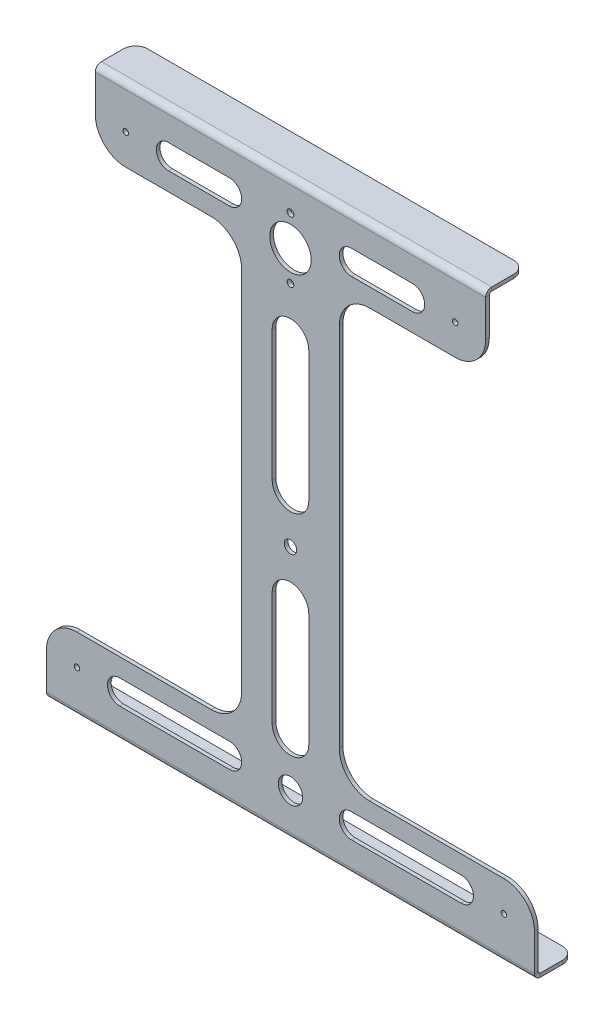
from build123d import *

# Parameters (mm, degrees)
ESQUISSE1_W                             = 400
ESQUISSE1_H                             = 470
BOSS_EXTRU_1_DEPTH                      = 3
T_LE_PLI_E_SUR_AR_TE1_STRIP_W           = 16
T_LE_PLI_E_SUR_AR_TE1_STRIP_H           = 3
T_LE_PLI_E_SUR_AR_TE1_STRIP_CUT_DEPTH   = 400
T_LE_PLI_E_SUR_AR_TE1_STRIP_2_W         = 16
T_LE_PLI_E_SUR_AR_TE1_STRIP_2_H         = 3
T_LE_PLI_E_SUR_AR_TE1_STRIP_CUT_2_DEPTH = 400
T_LE_PLI_E_SUR_AR_TE1_DEPTH             = 400
T_LE_PLI_E_SUR_AR_TE1_BEND_DEPTH        = 400
ENL_V_MAT_EXTRU_1_REACH                 = 513.849
ESQUISSE7_R                             = 5.1
ESQUISSE7_R_2                           = 17
ESQUISSE7_R_3                           = 2.75
ESQUISSE7_R_4                           = 2.25
ENL_V_MAT_EXTRU_6_REACH                 = 513.849
ESQUISSE14_R                            = 10
CONG_10_R                               = 10
CONG_2_R                                = 25
ENL_V_MAT_EXTRU_2_REACH                 = 513.664
ESQUISSE8_R                             = 2.25


# Sheet-metal steps are written as plain solids
with BuildPart() as part:
    # Esquisse1 → Boss.-Extru.1 (new body)
    with BuildSketch(Plane.XY):
        with Locations((0, 235)):
            Rectangle(ESQUISSE1_W, ESQUISSE1_H)
    extrude(amount=BOSS_EXTRU_1_DEPTH)

    # Tôle pliée sur arête1 strip (across the edge) → Tôle pliée sur arête1 strip cut (cut)
    with BuildSketch(Plane(origin=(-200, 470, 0), x_dir=(0, -1, 0), z_dir=(1, 0, 0))):
        with Locations((-3, -1.5)):
            Rectangle(T_LE_PLI_E_SUR_AR_TE1_STRIP_W, T_LE_PLI_E_SUR_AR_TE1_STRIP_H)
    extrude(amount=T_LE_PLI_E_SUR_AR_TE1_STRIP_CUT_DEPTH, mode=Mode.SUBTRACT)

    # Tôle pliée sur arête1 strip 2 (across the edge) → Tôle pliée sur arête1 strip cut 2 (cut)
    with BuildSketch(Plane(origin=(200, 0, 0), x_dir=(0, 1, 0), z_dir=(-1, 0, 0))):
        with Locations((-3, -1.5)):
            Rectangle(T_LE_PLI_E_SUR_AR_TE1_STRIP_2_W, T_LE_PLI_E_SUR_AR_TE1_STRIP_2_H)
    extrude(amount=T_LE_PLI_E_SUR_AR_TE1_STRIP_CUT_2_DEPTH, mode=Mode.SUBTRACT)

    # Tôle pliée sur arête1 section (across the edge) → Tôle pliée sur arête1 (add)
    with BuildSketch(Plane(origin=(-200, 470, 0), x_dir=(0, -1, 0), z_dir=(1, 0, 0))):
        with BuildLine():
            Line((0, 2), (0, 30))
            Line((0, 30), (3, 30))
            Line((3, 30), (3, 2))
            ThreePointArc((3, 2), (3.585786438, 0.585786438), (5, 0))
            Line((5, 0), (5, -3))
            ThreePointArc((5, -3), (1.464466094, -1.535533906), (0, 2))
        make_face()
    extrude(amount=T_LE_PLI_E_SUR_AR_TE1_DEPTH)

    # Tôle pliée sur arête1 section 2 (across the edge) → Tôle pliée sur arête1 bend (add)
    with BuildSketch(Plane(origin=(200, 0, 0), x_dir=(0, 1, 0), z_dir=(-1, 0, 0))):
        with BuildLine():
            Line((0, 2), (0, 30))
            Line((0, 30), (3, 30))
            Line((3, 30), (3, 2))
            ThreePointArc((3, 2), (3.585786438, 0.585786438), (5, 0))
            Line((5, 0), (5, -3))
            ThreePointArc((5, -3), (1.464466094, -1.535533906), (0, 2))
        make_face()
    extrude(amount=T_LE_PLI_E_SUR_AR_TE1_BEND_DEPTH)

    # Esquisse7 → Enlèv. mat.-Extru.1 (cut, up to next)
    with BuildSketch(Plane.XY.offset(3), mode=Mode.PRIVATE) as enl_v_mat_extru_1_sk1:
        with Locations((0, 208)):
            Circle(ESQUISSE7_R)
    enl_v_mat_extru_1_tool1 = extrude(enl_v_mat_extru_1_sk1.sketch, amount=-ENL_V_MAT_EXTRU_1_REACH, mode=Mode.PRIVATE) & part.part
    # Esquisse7 → Enlèv. mat.-Extru.1 (cut, up to next)
    with BuildSketch(Plane.XY.offset(3), mode=Mode.PRIVATE) as enl_v_mat_extru_1_sk2:
        with Locations((0, 420)):
            Circle(ESQUISSE7_R_2)
    enl_v_mat_extru_1_tool2 = extrude(enl_v_mat_extru_1_sk2.sketch, amount=-ENL_V_MAT_EXTRU_1_REACH, mode=Mode.PRIVATE) & part.part
    # Esquisse7 → Enlèv. mat.-Extru.1 (cut, up to next)
    with BuildSketch(Plane.XY.offset(3), mode=Mode.PRIVATE) as enl_v_mat_extru_1_sk3:
        with Locations((0, 445)):
            Circle(ESQUISSE7_R_3)
    enl_v_mat_extru_1_tool3 = extrude(enl_v_mat_extru_1_sk3.sketch, amount=-ENL_V_MAT_EXTRU_1_REACH, mode=Mode.PRIVATE) & part.part
    # Esquisse7 → Enlèv. mat.-Extru.1 (cut, up to next)
    with BuildSketch(Plane.XY.offset(3), mode=Mode.PRIVATE) as enl_v_mat_extru_1_sk4:
        with Locations((0, 395)):
            Circle(ESQUISSE7_R_3)
    enl_v_mat_extru_1_tool4 = extrude(enl_v_mat_extru_1_sk4.sketch, amount=-ENL_V_MAT_EXTRU_1_REACH, mode=Mode.PRIVATE) & part.part
    # Esquisse7 → Enlèv. mat.-Extru.1 (cut, up to next)
    with BuildSketch(Plane.XY.offset(3), mode=Mode.PRIVATE) as enl_v_mat_extru_1_sk5:
        with Locations((-175, 35)):
            Circle(ESQUISSE7_R_4)
    enl_v_mat_extru_1_tool5 = extrude(enl_v_mat_extru_1_sk5.sketch, amount=-ENL_V_MAT_EXTRU_1_REACH, mode=Mode.PRIVATE) & part.part
    # Esquisse7 → Enlèv. mat.-Extru.1 (cut, up to next)
    with BuildSketch(Plane.XY.offset(3), mode=Mode.PRIVATE) as enl_v_mat_extru_1_sk6:
        with Locations((175, 35)):
            Circle(ESQUISSE7_R_4)
    enl_v_mat_extru_1_tool6 = extrude(enl_v_mat_extru_1_sk6.sketch, amount=-ENL_V_MAT_EXTRU_1_REACH, mode=Mode.PRIVATE) & part.part
    # Esquisse7 → Enlèv. mat.-Extru.1 (cut, up to next)
    with BuildSketch(Plane.XY.offset(3), mode=Mode.PRIVATE) as enl_v_mat_extru_1_sk7:
        with Locations((-135, 435)):
            Circle(ESQUISSE7_R_4)
    enl_v_mat_extru_1_tool7 = extrude(enl_v_mat_extru_1_sk7.sketch, amount=-ENL_V_MAT_EXTRU_1_REACH, mode=Mode.PRIVATE) & part.part
    # Esquisse7 → Enlèv. mat.-Extru.1 (cut, up to next)
    with BuildSketch(Plane.XY.offset(3), mode=Mode.PRIVATE) as enl_v_mat_extru_1_sk8:
        with Locations((135, 435)):
            Circle(ESQUISSE7_R_4)
    enl_v_mat_extru_1_tool8 = extrude(enl_v_mat_extru_1_sk8.sketch, amount=-ENL_V_MAT_EXTRU_1_REACH, mode=Mode.PRIVATE) & part.part
    # Esquisse7 → Enlèv. mat.-Extru.1 (cut, up to next)
    with BuildSketch(Plane.XY.offset(3), mode=Mode.PRIVATE) as enl_v_mat_extru_1_sk9:
        Polygon((-200, 60), (-40, 60), (-40, 410), (-160, 410), (-160, 470), (-200, 470), align=None)
    enl_v_mat_extru_1_tool9 = extrude(enl_v_mat_extru_1_sk9.sketch, amount=-ENL_V_MAT_EXTRU_1_REACH, mode=Mode.PRIVATE) & part.part
    # Esquisse7 → Enlèv. mat.-Extru.1 (cut, up to next)
    with BuildSketch(Plane.XY.offset(3), mode=Mode.PRIVATE) as enl_v_mat_extru_1_sk10:
        Polygon((200, 470), (200, 60), (40, 60), (40, 410), (160, 410), (160, 470), align=None)
    enl_v_mat_extru_1_tool10 = extrude(enl_v_mat_extru_1_sk10.sketch, amount=-ENL_V_MAT_EXTRU_1_REACH, mode=Mode.PRIVATE) & part.part
    add(enl_v_mat_extru_1_tool1.solids().sort_by_distance((0, 208, 3))[0], mode=Mode.SUBTRACT)
    add(enl_v_mat_extru_1_tool2.solids().sort_by_distance((0, 420, 3))[0], mode=Mode.SUBTRACT)
    add(enl_v_mat_extru_1_tool3.solids().sort_by_distance((0, 445, 3))[0], mode=Mode.SUBTRACT)
    add(enl_v_mat_extru_1_tool4.solids().sort_by_distance((0, 395, 3))[0], mode=Mode.SUBTRACT)
    add(enl_v_mat_extru_1_tool5.solids().sort_by_distance((-175, 35, 3))[0], mode=Mode.SUBTRACT)
    add(enl_v_mat_extru_1_tool6.solids().sort_by_distance((175, 35, 3))[0], mode=Mode.SUBTRACT)
    add(enl_v_mat_extru_1_tool7.solids().sort_by_distance((-135, 435, 3))[0], mode=Mode.SUBTRACT)
    add(enl_v_mat_extru_1_tool8.solids().sort_by_distance((135, 435, 3))[0], mode=Mode.SUBTRACT)
    add(enl_v_mat_extru_1_tool9.solids().sort_by_distance((-122.465753, 243.424658, 3))[0], mode=Mode.SUBTRACT)
    add(enl_v_mat_extru_1_tool10.solids().sort_by_distance((122.465753, 243.424658, 3))[0], mode=Mode.SUBTRACT)

    # Esquisse14 → Enlèv. mat.-Extru.6 (cut, up to next)
    with BuildSketch(Plane.XY.offset(3), mode=Mode.PRIVATE) as enl_v_mat_extru_6_sk1:
        with Locations((0, 35)):
            Circle(ESQUISSE14_R)
    enl_v_mat_extru_6_tool1 = extrude(enl_v_mat_extru_6_sk1.sketch, amount=-ENL_V_MAT_EXTRU_6_REACH, mode=Mode.PRIVATE) & part.part
    # Esquisse14 → Enlèv. mat.-Extru.6 (cut, up to next)
    with BuildSketch(Plane.XY.offset(3), mode=Mode.PRIVATE) as enl_v_mat_extru_6_sk2:
        with BuildLine():
            Line((-140, 45), (-50, 45))
            ThreePointArc((-50, 45), (-40, 35), (-50, 25))
            Line((-50, 25), (-140, 25))
            ThreePointArc((-140, 25), (-150, 35), (-140, 45))
        make_face()
    enl_v_mat_extru_6_tool2 = extrude(enl_v_mat_extru_6_sk2.sketch, amount=-ENL_V_MAT_EXTRU_6_REACH, mode=Mode.PRIVATE) & part.part
    # Esquisse14 → Enlèv. mat.-Extru.6 (cut, up to next)
    with BuildSketch(Plane.XY.offset(3), mode=Mode.PRIVATE) as enl_v_mat_extru_6_sk3:
        with BuildLine():
            Line((50, 45), (140, 45))
            ThreePointArc((140, 45), (150, 35), (140, 25))
            Line((140, 25), (50, 25))
            ThreePointArc((50, 25), (40, 35), (50, 45))
        make_face()
    enl_v_mat_extru_6_tool3 = extrude(enl_v_mat_extru_6_sk3.sketch, amount=-ENL_V_MAT_EXTRU_6_REACH, mode=Mode.PRIVATE) & part.part
    # Esquisse14 → Enlèv. mat.-Extru.6 (cut, up to next)
    with BuildSketch(Plane.XY.offset(3), mode=Mode.PRIVATE) as enl_v_mat_extru_6_sk4:
        with BuildLine():
            Line((-15, 168), (-15, 75))
            ThreePointArc((-15, 75), (0, 60), (15, 75))
            Line((15, 75), (15, 168))
            ThreePointArc((15, 168), (0, 183), (-15, 168))
        make_face()
    enl_v_mat_extru_6_tool4 = extrude(enl_v_mat_extru_6_sk4.sketch, amount=-ENL_V_MAT_EXTRU_6_REACH, mode=Mode.PRIVATE) & part.part
    # Esquisse14 → Enlèv. mat.-Extru.6 (cut, up to next)
    with BuildSketch(Plane.XY.offset(3), mode=Mode.PRIVATE) as enl_v_mat_extru_6_sk5:
        with BuildLine():
            Line((-15, 355), (-15, 248))
            ThreePointArc((-15, 248), (0, 233), (15, 248))
            Line((15, 248), (15, 355))
            ThreePointArc((15, 355), (0, 370), (-15, 355))
        make_face()
    enl_v_mat_extru_6_tool5 = extrude(enl_v_mat_extru_6_sk5.sketch, amount=-ENL_V_MAT_EXTRU_6_REACH, mode=Mode.PRIVATE) & part.part
    # Esquisse14 → Enlèv. mat.-Extru.6 (cut, up to next)
    with BuildSketch(Plane.XY.offset(3), mode=Mode.PRIVATE) as enl_v_mat_extru_6_sk6:
        with BuildLine():
            Line((100, 445), (50, 445))
            ThreePointArc((50, 445), (40, 435), (50, 425))
            Line((50, 425), (100, 425))
            ThreePointArc((100, 425), (110, 435), (100, 445))
        make_face()
    enl_v_mat_extru_6_tool6 = extrude(enl_v_mat_extru_6_sk6.sketch, amount=-ENL_V_MAT_EXTRU_6_REACH, mode=Mode.PRIVATE) & part.part
    # Esquisse14 → Enlèv. mat.-Extru.6 (cut, up to next)
    with BuildSketch(Plane.XY.offset(3), mode=Mode.PRIVATE) as enl_v_mat_extru_6_sk7:
        with BuildLine():
            Line((-50, 445), (-100, 445))
            ThreePointArc((-100, 445), (-110, 435), (-100, 425))
            Line((-100, 425), (-50, 425))
            ThreePointArc((-50, 425), (-40, 435), (-50, 445))
        make_face()
    enl_v_mat_extru_6_tool7 = extrude(enl_v_mat_extru_6_sk7.sketch, amount=-ENL_V_MAT_EXTRU_6_REACH, mode=Mode.PRIVATE) & part.part
    add(enl_v_mat_extru_6_tool1.solids().sort_by_distance((0, 35, 3))[0], mode=Mode.SUBTRACT)
    add(enl_v_mat_extru_6_tool2.solids().sort_by_distance((-95, 35, 3))[0], mode=Mode.SUBTRACT)
    add(enl_v_mat_extru_6_tool3.solids().sort_by_distance((95, 35, 3))[0], mode=Mode.SUBTRACT)
    add(enl_v_mat_extru_6_tool4.solids().sort_by_distance((0, 121.5, 3))[0], mode=Mode.SUBTRACT)
    add(enl_v_mat_extru_6_tool5.solids().sort_by_distance((0, 301.5, 3))[0], mode=Mode.SUBTRACT)
    add(enl_v_mat_extru_6_tool6.solids().sort_by_distance((75, 435, 3))[0], mode=Mode.SUBTRACT)
    add(enl_v_mat_extru_6_tool7.solids().sort_by_distance((-75, 435, 3))[0], mode=Mode.SUBTRACT)

    # Congé 10
    cong_10_edges = [part.edges().sort_by_distance(p)[0] for p in [
        (160, 468.5, -30),
        (200, 1.5, -30),
        (-200, 1.5, -30),
        (-160, 468.5, -30),
    ]]
    fillet(cong_10_edges, radius=CONG_10_R)

    # Congé2
    cong_2_edges = [part.edges().sort_by_distance(p)[0] for p in [
        (200, 60, 1.5),
        (40, 60, 1.5),
        (40, 410, 1.5),
        (160, 410, 1.5),
        (-200, 60, 1.5),
        (-160, 410, 1.5),
        (-40, 410, 1.5),
        (-40, 60, 1.5),
    ]]
    fillet(cong_2_edges, radius=CONG_2_R)

    # Esquisse8 → Enlèv. mat.-Extru.2 (cut, up to next)
    with BuildSketch(Plane(origin=(0, 0, 0), x_dir=(-1, 0, 0), z_dir=(0, -1, 0)), mode=Mode.PRIVATE) as enl_v_mat_extru_2_sk1:
        with Locations(Location((175, 15, 0), (0, 0, 90))):
            Circle(ESQUISSE8_R)
    enl_v_mat_extru_2_tool1 = extrude(enl_v_mat_extru_2_sk1.sketch, amount=-ENL_V_MAT_EXTRU_2_REACH, mode=Mode.PRIVATE) & part.part
    # Esquisse8 → Enlèv. mat.-Extru.2 (cut, up to next)
    with BuildSketch(Plane(origin=(0, 0, 0), x_dir=(-1, 0, 0), z_dir=(0, -1, 0)), mode=Mode.PRIVATE) as enl_v_mat_extru_2_sk2:
        with Locations(Location((-175, 15, 0), (0, 0, 90))):
            Circle(ESQUISSE8_R)
    enl_v_mat_extru_2_tool2 = extrude(enl_v_mat_extru_2_sk2.sketch, amount=-ENL_V_MAT_EXTRU_2_REACH, mode=Mode.PRIVATE) & part.part
    add(enl_v_mat_extru_2_tool1.solids().sort_by_distance((-175, 0, -15))[0], mode=Mode.SUBTRACT)
    add(enl_v_mat_extru_2_tool2.solids().sort_by_distance((175, 0, -15))[0], mode=Mode.SUBTRACT)


solid = part.part
